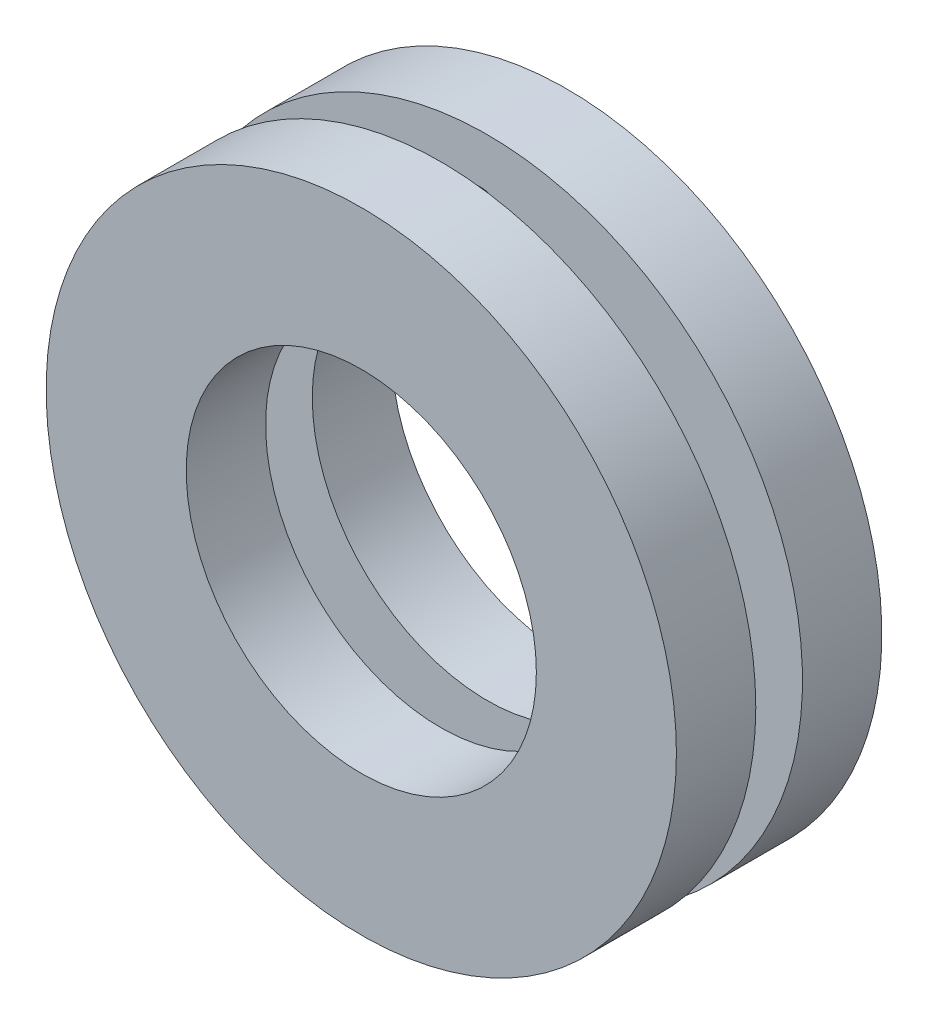
from build123d import *

# Parameters (mm, degrees)
SKETCH_1_R          = 67.5
EXTRUDE_1_DEPTH     = 17
EXTRUDE_START       = 17
SKETCH_5_R          = 67.5
SKETCH_5_R_2        = 37.5
EXTRUDE_2_DEPTH     = 17
SKETCH_6_R          = 37.5
CUT_EXTRUDE_1_DEPTH = 30


with BuildPart() as part:
    # 草图1 → 拉伸1 (new body)
    with BuildSketch(Plane.XY):
        Circle(SKETCH_1_R)
    extrude(amount=EXTRUDE_1_DEPTH)

    # 草图6 → 切除-拉伸1 (cut)
    with BuildSketch(Plane.XY.offset(17)):
        Circle(SKETCH_6_R)
    extrude(amount=-CUT_EXTRUDE_1_DEPTH, mode=Mode.SUBTRACT)


with BuildPart() as body_2:
    # 草图3 → 旋转1 (revolve)
    with BuildSketch(Plane(origin=(0, 0, 0), x_dir=(0, 0, -1), z_dir=(1, 0, 0))):
        with BuildLine():
            Line((0, 55), (10, 55))
            ThreePointArc((10, 55), (5, 60), (0, 55))
        make_face()
    revolve(axis=Axis((0, 55, 0), (0, 0, -1)))


with BuildPart() as body_3:
    # 草图5 → 拉伸2 (new body)
    with BuildSketch(Plane(origin=(0, 0, -10), x_dir=(-1, 0, 0), z_dir=(0, 0, -1)).offset(EXTRUDE_START)):
        Circle(SKETCH_5_R)
        Circle(SKETCH_5_R_2, mode=Mode.SUBTRACT)
    extrude(amount=-EXTRUDE_2_DEPTH)


solid = Compound([part.part, body_2.part, body_3.part])
